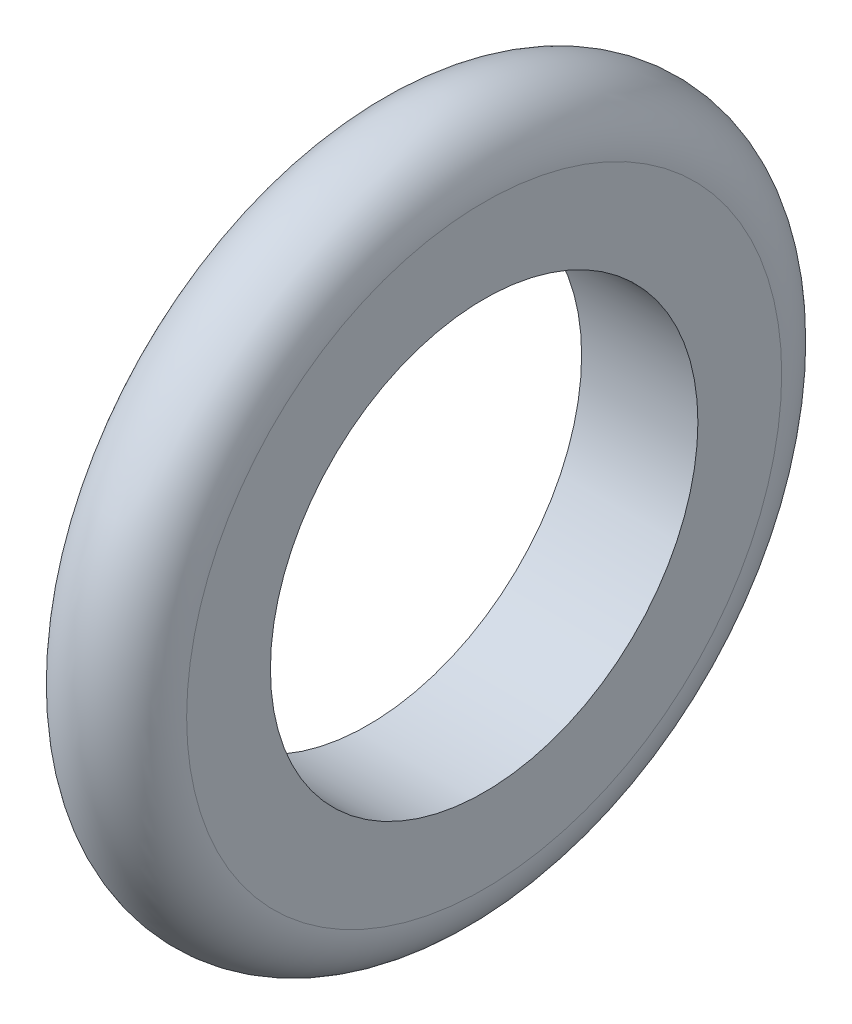
from build123d import *

# Parameters (mm, degrees)
SKETCH1_R           = 6.604
SKETCH1_R_2         = 3.96875
BOSS_EXTRUDE1_DEPTH = 2.159
FILLET1_R           = 1.0795


with BuildPart() as part:
    # Sketch1 → Boss-Extrude1 (new body)
    with BuildSketch(Plane(origin=(0, 0, 0), x_dir=(0, 0, -1), z_dir=(1, 0, 0))):
        Circle(SKETCH1_R)
        Circle(SKETCH1_R_2, mode=Mode.SUBTRACT)
    extrude(amount=BOSS_EXTRUDE1_DEPTH)

    # Fillet1
    fillet1_edges = [part.edges().sort_by_distance(p)[0] for p in [
        (0, 0, 6.604),
        (2.159, 0, 6.604),
    ]]
    fillet(fillet1_edges, radius=FILLET1_R - 0.0001)  # a hair under: the kernel refuses the full size


solid = part.part
